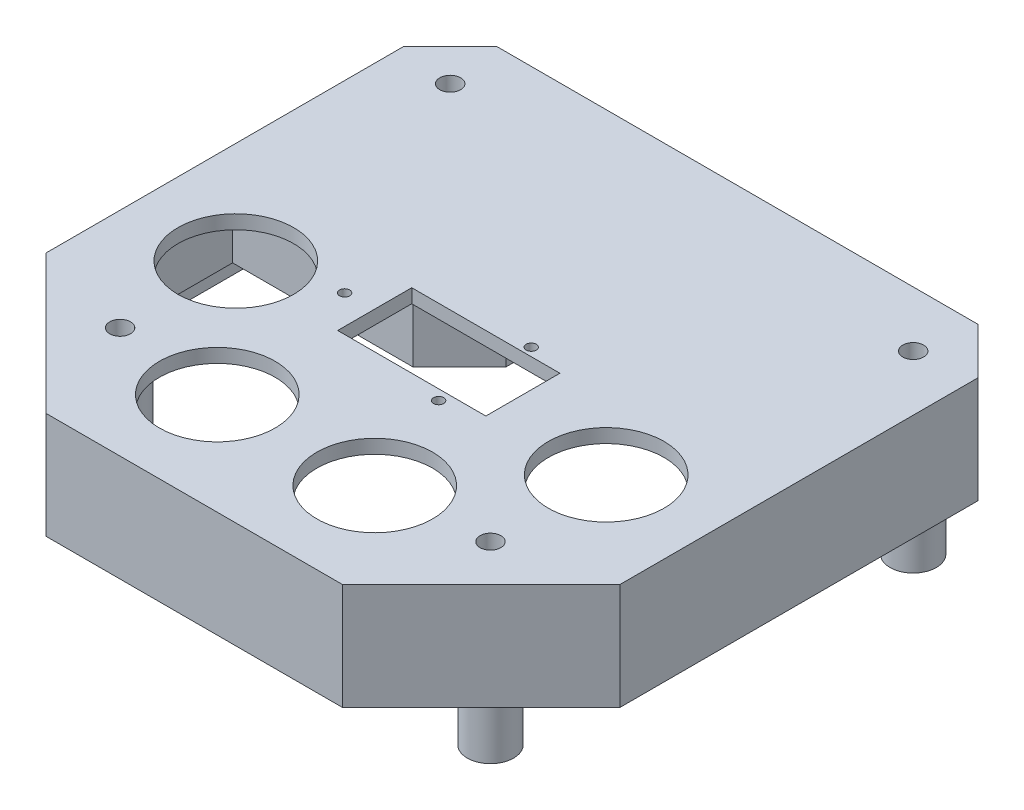
from build123d import *

# Parameters (mm, degrees)
ESQUISSE1_W             = 124
ESQUISSE1_H             = 117.305460094
ESQUISSE1_R             = 12.5
ESQUISSE1_W_2           = 32
ESQUISSE1_H_2           = 16
BOSS_EXTRU_1_DEPTH      = 3
ESQUISSE3_R             = 1.1
ENL_V_MAT_EXTRU_1_DEPTH = 114.737112341
CHANFREIN1_SIZE         = 30
CHANFREIN2_SIZE         = 10
ESQUISSE4_R             = 2.25
ENL_V_MAT_EXTRU_2_DEPTH = 114.737112341
BOSS_EXTRU_2_START      = -35
ESQUISSE4_3_R           = 5
ESQUISSE4_3_R_2         = 2.25
BOSS_EXTRU_2_DEPTH      = 35
BOSS_EXTRU_3_DEPTH      = 20
BOSS_EXTRU_4_DEPTH      = 15
ENL_V_MAT_EXTRU_4_DEPTH = 119.962728296
ENL_V_MAT_EXTRU_6_DEPTH = 119.962728296
NERVURE1_REACH          = 131.26
ESQUISSE8_WALL_W        = 272.726425054
ESQUISSE8_WALL_H        = 2
NERVURE2_REACH          = 132.507
ESQUISSE9_WALL_W        = 275.220966894
ESQUISSE9_WALL_H        = 2
NERVURE3_REACH          = 104.189
ESQUISSE10_WALL_W       = 218.585522044
ESQUISSE10_WALL_H       = 2
NERVURE4_REACH          = 104.189
ESQUISSE11_WALL_W       = 218.585522044
ESQUISSE11_WALL_H       = 2
NERVURE5_REACH          = 153.169
ESQUISSE12_WALL_W       = 307.338424442
ESQUISSE12_WALL_H       = 2
NERVURE6_REACH          = 129.115
ESQUISSE13_WALL_W       = 259.230131382
ESQUISSE13_WALL_H       = 2
NERVURE7_REACH          = 129.115
ESQUISSE14_WALL_W       = 259.230131382
ESQUISSE14_WALL_H       = 2
NERVURE8_REACH          = 153.169
ESQUISSE15_WALL_W       = 307.338424442
ESQUISSE15_WALL_H       = 2
NERVURE9_REACH          = 119.367
ESQUISSE16_WALL_W       = 245.04129034
ESQUISSE16_WALL_H       = 2
NERVURE11_REACH         = 119.367
ESQUISSE17_WALL_W       = 245.578757666
ESQUISSE17_WALL_H       = 2
NERVURE12_REACH         = 145.917
ESQUISSE18_WALL_W       = 295.356537138
ESQUISSE18_WALL_H       = 2
NERVURE13_REACH         = 145.917
ESQUISSE19_WALL_W       = 296.177339158
ESQUISSE19_WALL_H       = 2
BOSS_EXTRU_5_DEPTH      = 2
BOSS_EXTRU_5_DEPTH_BACK = 1
ESQUISSE20_W            = 45
ESQUISSE20_H            = 15
BOSS_EXTRU_6_DEPTH      = 2
BOSS_EXTRU_6_DEPTH_BACK = 1
ESQUISSE21_W            = 49
ESQUISSE21_H            = 15
CHANFREIN3_SIZE         = 8
CHANFREIN4_SIZE         = 10


with BuildPart() as part:
    # Esquisse1 → Boss.-Extru.1 (new body)
    with BuildSketch(Plane(origin=(0, 0, 0), x_dir=(1, 0, 0), z_dir=(0, 1, 0))):
        with Locations((0, 36.652730047)):
            Rectangle(ESQUISSE1_W, ESQUISSE1_H)
        with Locations((-40, 27)):
            Circle(ESQUISSE1_R, mode=Mode.SUBTRACT)
        with Locations((-17, 0)):
            Circle(ESQUISSE1_R, mode=Mode.SUBTRACT)
        with Locations((17, 0)):
            Circle(ESQUISSE1_R, mode=Mode.SUBTRACT)
        with Locations((40, 27)):
            Circle(ESQUISSE1_R, mode=Mode.SUBTRACT)
        with Locations((0, 33)):
            Rectangle(ESQUISSE1_W_2, ESQUISSE1_H_2, mode=Mode.SUBTRACT)
    extrude(amount=BOSS_EXTRU_1_DEPTH)

    # Esquisse3 → Enlèv. mat.-Extru.1 (cut, through all)
    with BuildSketch(Plane(origin=(0, 0, 0), x_dir=(1, 0, 0), z_dir=(0, 1, 0))):
        with Locations((8.021018959, 22.783184136)):
            Circle(ESQUISSE3_R)
        with Locations((-22.278981041, 32.783184136)):
            Circle(ESQUISSE3_R)
        with Locations((8.021018959, 42.783184136)):
            Circle(ESQUISSE3_R)
    extrude(amount=ENL_V_MAT_EXTRU_1_DEPTH, mode=Mode.SUBTRACT)

    # Chanfrein1
    chanfrein1_edges = [part.edges().sort_by_distance(p)[0] for p in [
        (-62, 1.5, 22),
        (62, 1.5, 22),
    ]]
    chamfer(chanfrein1_edges, length=CHANFREIN1_SIZE)

    # Chanfrein2
    chanfrein2_edges = [part.edges().sort_by_distance(p)[0] for p in [
        (62, 1.5, -95.305460094),
        (-62, 1.5, -95.305460094),
    ]]
    chamfer(chanfrein2_edges, length=CHANFREIN2_SIZE)

    # Esquisse4 → Enlèv. mat.-Extru.2 (cut, through all)
    with BuildSketch(Plane(origin=(0, 0, 0), x_dir=(1, 0, 0), z_dir=(0, 1, 0))):
        with Locations((-40, 2)):
            Circle(ESQUISSE4_R)
        with Locations((40, 2)):
            Circle(ESQUISSE4_R)
        with Locations((50, 83.305460094)):
            Circle(ESQUISSE4_R)
        with Locations((-50, 83.305460094)):
            Circle(ESQUISSE4_R)
    extrude(amount=ENL_V_MAT_EXTRU_2_DEPTH, mode=Mode.SUBTRACT)

    # Esquisse4<3> → Boss.-Extru.2 (add)
    # profile 1 of 4: a face of its own
    with BuildSketch(Plane(origin=(0, 0, 0), x_dir=(1, 0, 0), z_dir=(0, 1, 0)).offset(BOSS_EXTRU_2_START)):
        with Locations((-40, 2)):
            Circle(ESQUISSE4_3_R)
        with Locations((-40, 2)):
            Circle(ESQUISSE4_3_R_2, mode=Mode.SUBTRACT)
    # profile 2 of 4: a face of its own
    with BuildSketch(Plane(origin=(0, 0, 0), x_dir=(1, 0, 0), z_dir=(0, 1, 0)).offset(BOSS_EXTRU_2_START)):
        with Locations((40, 2)):
            Circle(ESQUISSE4_3_R)
        with Locations((40, 2)):
            Circle(ESQUISSE4_3_R_2, mode=Mode.SUBTRACT)
    # profile 3 of 4: a face of its own
    with BuildSketch(Plane(origin=(0, 0, 0), x_dir=(1, 0, 0), z_dir=(0, 1, 0)).offset(BOSS_EXTRU_2_START)):
        with Locations((50, 83.305460094)):
            Circle(ESQUISSE4_3_R)
        with Locations((50, 83.305460094)):
            Circle(ESQUISSE4_3_R_2, mode=Mode.SUBTRACT)
    # profile 4 of 4: a face of its own
    with BuildSketch(Plane(origin=(0, 0, 0), x_dir=(1, 0, 0), z_dir=(0, 1, 0)).offset(BOSS_EXTRU_2_START)):
        with Locations((-50, 83.305460094)):
            Circle(ESQUISSE4_3_R)
        with Locations((-50, 83.305460094)):
            Circle(ESQUISSE4_3_R_2, mode=Mode.SUBTRACT)
    extrude(amount=BOSS_EXTRU_2_DEPTH)

    # Esquisse5 → Boss.-Extru.3 (add)
    with BuildSketch(Plane(origin=(0, 0, 0), x_dir=(1, 0, 0), z_dir=(0, 1, 0))):
        Polygon((-52, 95.305460094), (-62, 85.305460094), (-62, 8), (-32, -22), (32, -22), (62, 8), (62, 85.305460094), (52, 95.305460094), align=None)
        Polygon((-60.7, 8.538477631), (-60.7, 84.766982462), (-51.461522369, 94.005460094), (51.461522369, 94.005460094), (60.172192098, 85.294790364), (60.172192098, 8.010669729), (31.461522369, -20.7), (-31.461522369, -20.7), align=None, mode=Mode.SUBTRACT)
    extrude(amount=-BOSS_EXTRU_3_DEPTH)

    # Esquisse5<3> → Boss.-Extru.4 (add)
    with BuildSketch(Plane(origin=(0, 0, 0), x_dir=(1, 0, 0), z_dir=(0, 1, 0))):
        Polygon((-51.461522369, 94.005460094), (-60.7, 84.766982462), (-60.7, 8.538477631), (-31.461522369, -20.7), (31.461522369, -20.7), (60.172192098, 8.010669729), (60.172192098, 85.294790364), (51.461522369, 94.005460094), align=None)
        Polygon((-58, 9.656854249), (-58, 83.648605844), (-50.343145751, 91.305460094), (50.343145751, 91.305460094), (58, 83.648605844), (58, 9.656854249), (30.343145751, -18), (-30.343145751, -18), align=None, mode=Mode.SUBTRACT)
    extrude(amount=-BOSS_EXTRU_4_DEPTH)

    # Esquisse6 → Enlèv. mat.-Extru.4 (cut, through all)
    with BuildSketch(Plane(origin=(0, 0, 0), x_dir=(0, 0, -1), z_dir=(1, 0, 0))):
        with BuildLine():
            Line((51.555460094, -20), (59.055460094, -20))
            Line((59.055460094, -20), (59.055460094, -15))
            ThreePointArc((59.055460094, -15), (55.305460094, -11.25), (51.555460094, -15))
            Line((51.555460094, -15), (51.555460094, -20))
        make_face()
    extrude(amount=-ENL_V_MAT_EXTRU_4_DEPTH, mode=Mode.SUBTRACT)

    # Esquisse7 → Enlèv. mat.-Extru.6 (cut, through all)
    with BuildSketch(Plane.XY):
        with BuildLine():
            ThreePointArc((-18.25, -15), (-22, -11.25), (-25.75, -15))
            Line((-25.75, -15), (-25.75, -20))
            Line((-25.75, -20), (-18.25, -20))
            Line((-18.25, -20), (-18.25, -15))
        make_face()
    extrude(amount=-ENL_V_MAT_EXTRU_6_DEPTH, mode=Mode.SUBTRACT)

    # Esquisse8 wall → Nervure1 (add, up to next)
    with BuildSketch(Plane(origin=(18, -5, -87.805460094), x_dir=(0, 0.819231920519, 0.573462344363), z_dir=(0, 0.573462344363, -0.819231920519)), mode=Mode.PRIVATE) as nervure1_sk1:
        Rectangle(ESQUISSE8_WALL_W, ESQUISSE8_WALL_H)
    nervure1_tool1 = extrude(nervure1_sk1.sketch, amount=NERVURE1_REACH, mode=Mode.PRIVATE) - part.part
    add(nervure1_tool1.solids().sort_by_distance((18, -5, -87.805460094))[0])

    # Esquisse9 wall → Nervure2 (add, up to next)
    with BuildSketch(Plane(origin=(-20, -5, -87.805460094), x_dir=(0, 0.819231920519, 0.573462344363), z_dir=(0, 0.573462344363, -0.819231920519)), mode=Mode.PRIVATE) as nervure2_sk1:
        Rectangle(ESQUISSE9_WALL_W, ESQUISSE9_WALL_H)
    nervure2_tool1 = extrude(nervure2_sk1.sketch, amount=NERVURE2_REACH, mode=Mode.PRIVATE) - part.part
    add(nervure2_tool1.solids().sort_by_distance((-20, -5, -87.805460094))[0])

    # Esquisse10 wall → Nervure3 (add, up to next)
    with BuildSketch(Plane(origin=(54.5, -5, -51.305460094), x_dir=(-0.573462344363, 0.819231920519, 0), z_dir=(-0.819231920519, -0.573462344363, 0)), mode=Mode.PRIVATE) as nervure3_sk1:
        Rectangle(ESQUISSE10_WALL_W, ESQUISSE10_WALL_H)
    nervure3_tool1 = extrude(nervure3_sk1.sketch, amount=-NERVURE3_REACH, mode=Mode.PRIVATE) - part.part
    add(nervure3_tool1.solids().sort_by_distance((54.5, -5, -51.305460094))[0])

    # Esquisse11 wall → Nervure4 (add, up to next)
    with BuildSketch(Plane(origin=(-54.5, -5, -51.305460094), x_dir=(0.573462344363, 0.819231920519, 0), z_dir=(-0.819231920519, 0.573462344363, 0)), mode=Mode.PRIVATE) as nervure4_sk1:
        Rectangle(ESQUISSE11_WALL_W, ESQUISSE11_WALL_H)
    nervure4_tool1 = extrude(nervure4_sk1.sketch, amount=NERVURE4_REACH, mode=Mode.PRIVATE) - part.part
    add(nervure4_tool1.solids().sort_by_distance((-54.5, -5, -51.305460094))[0])

    # Esquisse12 wall → Nervure5 (add, up to next)
    with BuildSketch(Plane(origin=(50, -10, -89.805460094), x_dir=(0, 0, 1), z_dir=(0, 1, 0)), mode=Mode.PRIVATE) as nervure5_sk1:
        Rectangle(ESQUISSE12_WALL_W, ESQUISSE12_WALL_H)
    nervure5_tool1 = extrude(nervure5_sk1.sketch, amount=NERVURE5_REACH, mode=Mode.PRIVATE) - part.part
    add(nervure5_tool1.solids().sort_by_distance((50, -10, -89.805460094))[0])

    # Esquisse13 wall → Nervure6 (add, up to next)
    with BuildSketch(Plane(origin=(56.5, -10, -83.305460094), x_dir=(-1, 0, 0), z_dir=(0, -1, 0)), mode=Mode.PRIVATE) as nervure6_sk1:
        Rectangle(ESQUISSE13_WALL_W, ESQUISSE13_WALL_H)
    nervure6_tool1 = extrude(nervure6_sk1.sketch, amount=-NERVURE6_REACH, mode=Mode.PRIVATE) - part.part
    add(nervure6_tool1.solids().sort_by_distance((56.5, -10, -83.305460094))[0])

    # Esquisse14 wall → Nervure7 (add, up to next)
    with BuildSketch(Plane(origin=(-56.5, -10, -83.305460094), x_dir=(1, 0, 0), z_dir=(0, 1, 0)), mode=Mode.PRIVATE) as nervure7_sk1:
        Rectangle(ESQUISSE14_WALL_W, ESQUISSE14_WALL_H)
    nervure7_tool1 = extrude(nervure7_sk1.sketch, amount=NERVURE7_REACH, mode=Mode.PRIVATE) - part.part
    add(nervure7_tool1.solids().sort_by_distance((-56.5, -10, -83.305460094))[0])

    # Esquisse15 wall → Nervure8 (add, up to next)
    with BuildSketch(Plane(origin=(-50, -10, -89.805460094), x_dir=(0, 0, 1), z_dir=(0, -1, 0)), mode=Mode.PRIVATE) as nervure8_sk1:
        Rectangle(ESQUISSE15_WALL_W, ESQUISSE15_WALL_H)
    nervure8_tool1 = extrude(nervure8_sk1.sketch, amount=-NERVURE8_REACH, mode=Mode.PRIVATE) - part.part
    add(nervure8_tool1.solids().sort_by_distance((-50, -10, -89.805460094))[0])

    # Esquisse16 wall → Nervure9 (add, up to next)
    with BuildSketch(Plane(origin=(-49.154087398, -10, -2), x_dir=(1, 0, 0), z_dir=(0, -1, 0)), mode=Mode.PRIVATE) as nervure9_sk1:
        Rectangle(ESQUISSE16_WALL_W, ESQUISSE16_WALL_H)
    nervure9_tool1 = extrude(nervure9_sk1.sketch, amount=-NERVURE9_REACH, mode=Mode.PRIVATE) - part.part
    add(nervure9_tool1.solids().sort_by_distance((-49.154087398, -10, -2))[0])

    # Esquisse17 wall → Nervure11 (add, up to next)
    with BuildSketch(Plane(origin=(49.42282106, -10, -2), x_dir=(-1, 0, 0), z_dir=(0, 1, 0)), mode=Mode.PRIVATE) as nervure11_sk1:
        Rectangle(ESQUISSE17_WALL_W, ESQUISSE17_WALL_H)
    nervure11_tool1 = extrude(nervure11_sk1.sketch, amount=NERVURE11_REACH, mode=Mode.PRIVATE) - part.part
    add(nervure11_tool1.solids().sort_by_distance((49.42282106, -10, -2))[0])

    # Esquisse18 wall → Nervure12 (add, up to next)
    with BuildSketch(Plane(origin=(40, -10, 5.761171865), x_dir=(0, 0, 1), z_dir=(0, 1, 0)), mode=Mode.PRIVATE) as nervure12_sk1:
        Rectangle(ESQUISSE18_WALL_W, ESQUISSE18_WALL_H)
    nervure12_tool1 = extrude(nervure12_sk1.sketch, amount=NERVURE12_REACH, mode=Mode.PRIVATE) - part.part
    add(nervure12_tool1.solids().sort_by_distance((40, -10, 5.761171865))[0])

    # Esquisse19 wall → Nervure13 (add, up to next)
    with BuildSketch(Plane(origin=(-40, -10, 6.171572875), x_dir=(0, 0, 1), z_dir=(0, -1, 0)), mode=Mode.PRIVATE) as nervure13_sk1:
        Rectangle(ESQUISSE19_WALL_W, ESQUISSE19_WALL_H)
    nervure13_tool1 = extrude(nervure13_sk1.sketch, amount=-NERVURE13_REACH, mode=Mode.PRIVATE) - part.part
    add(nervure13_tool1.solids().sort_by_distance((-40, -10, 6.171572875))[0])

    # Esquisse20 → Boss.-Extru.5 (add, two sides: drawn at the far end of the back side and taken through both)
    with BuildSketch(Plane(origin=(-11, 0, 0), x_dir=(0, 0, -1), z_dir=(1, 0, 0)).offset(-BOSS_EXTRU_5_DEPTH_BACK)):
        with Locations((68.805460094, -7.5)):
            Rectangle(ESQUISSE20_W, ESQUISSE20_H)
    extrude(amount=BOSS_EXTRU_5_DEPTH + BOSS_EXTRU_5_DEPTH_BACK)

    # Esquisse21 → Boss.-Extru.6 (add, two sides: drawn at the far end of the back side and taken through both)
    with BuildSketch(Plane.XY.offset(-46.305460094).offset(-BOSS_EXTRU_6_DEPTH_BACK)):
        with Locations((-33.5, -7.5)):
            Rectangle(ESQUISSE21_W, ESQUISSE21_H)
    extrude(amount=BOSS_EXTRU_6_DEPTH + BOSS_EXTRU_6_DEPTH_BACK)

    # Chanfrein3
    chanfrein3_edges = [part.edges().sort_by_distance(p)[0] for p in [
        (-12, -7.5, -47.305460094),
    ]]
    chamfer(chanfrein3_edges, length=CHANFREIN3_SIZE)

    # Chanfrein4
    chanfrein4_edges = [part.edges().sort_by_distance(p)[0] for p in [
        (-9, -7.5, -44.305460094),
    ]]
    chamfer(chanfrein4_edges, length=CHANFREIN4_SIZE)


solid = part.part
